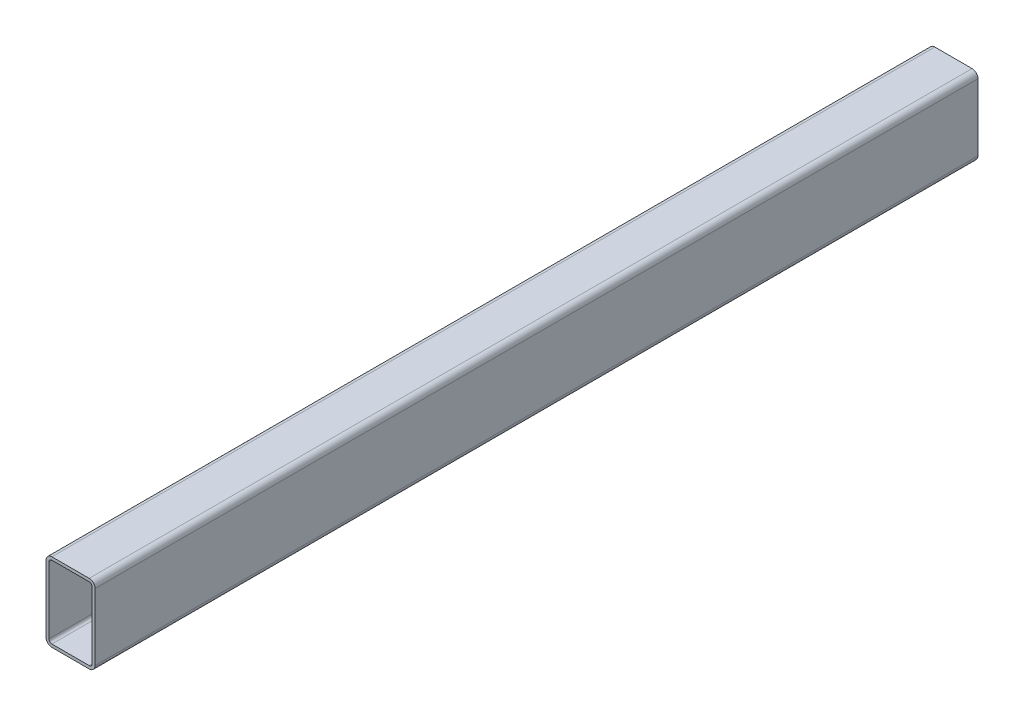
from build123d import *

# Parameters (mm, degrees)
BOSS_EXTRUDE1_DEPTH = 450


with BuildPart() as part:
    # Sketch1 → Boss-Extrude1 (new, symmetric)
    with BuildSketch(Plane.XY):
        with BuildLine():
            Line((19, -40), (-19, -40))
            ThreePointArc((-19, -40), (-23.242640687, -38.242640687), (-25, -34))
            Line((-25, -34), (-25, 34))
            ThreePointArc((-25, 34), (-23.242640687, 38.242640687), (-19, 40))
            Line((-19, 40), (19, 40))
            ThreePointArc((19, 40), (23.242640687, 38.242640687), (25, 34))
            Line((25, 34), (25, -34))
            ThreePointArc((25, -34), (23.242640687, -38.242640687), (19, -40))
        make_face()
        with BuildLine():
            Line((19, 37), (-19, 37))
            ThreePointArc((-19, 37), (-21.121320344, 36.121320344), (-22, 34))
            Line((-22, 34), (-22, -34))
            ThreePointArc((-22, -34), (-21.121320344, -36.121320344), (-19, -37))
            Line((-19, -37), (19, -37))
            ThreePointArc((19, -37), (21.121320344, -36.121320344), (22, -34))
            Line((22, -34), (22, 34))
            ThreePointArc((22, 34), (21.121320344, 36.121320344), (19, 37))
        make_face(mode=Mode.SUBTRACT)
    extrude(amount=BOSS_EXTRUDE1_DEPTH, both=True)


solid = part.part
